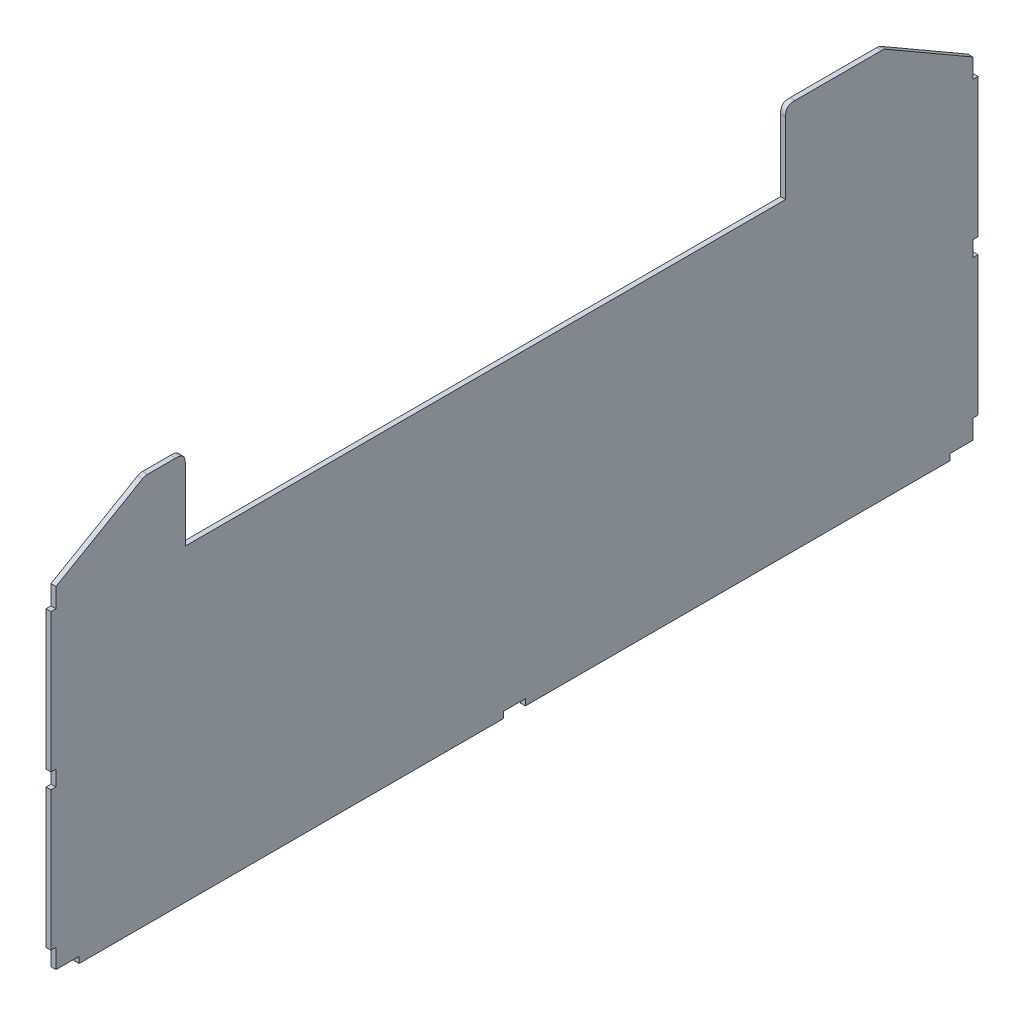
from build123d import *

# Parameters (mm, degrees)
BASE_FLANGE1_DEPTH  = 2.588
SKETCH2_W           = 2.588
SKETCH2_H           = 72
BOSS_EXTRUDE1_DEPTH = 2.588
SKETCH3_W           = 2.588
SKETCH3_H           = 220
BOSS_EXTRUDE2_DEPTH = 3.264
SKETCH4_W           = 2.588
SKETCH4_H           = 72
BOSS_EXTRUDE3_DEPTH = 2.5888
FILLET1_SIZE        = 5


# Sheet-metal steps are written as plain solids
with BuildPart() as part:
    # Base-Flange1: sheet metal written as solids
    # Sketch1 → Base-Flange1 (new body)
    with BuildSketch(Plane(origin=(0, 0, 0), x_dir=(0, 0, -1), z_dir=(1, 0, 0))):
        Polygon((0, 172), (46.072551481, 198.6), (67, 198.6), (67, 156.6), (378.084, 156.6), (378.084, 198.6), (429.151448519, 198.6), (475.224, 172), (475.224, 0), (0, 0), align=None)
    extrude(amount=-BASE_FLANGE1_DEPTH)

    # Sketch2 → Boss-Extrude1 (add)
    with BuildSketch(Plane(origin=(0, 0, -475.224), x_dir=(-1, 0, 0), z_dir=(0, 0, -1))):
        with Locations((1.294, 126)):
            Rectangle(SKETCH2_W, SKETCH2_H)
        with Locations((1.294, 46)):
            Rectangle(SKETCH2_W, SKETCH2_H)
    extrude(amount=BOSS_EXTRUDE1_DEPTH)

    # Sketch3 → Boss-Extrude2 (add)
    with BuildSketch(Plane.XZ):
        with Locations((-1.294, -122)):
            Rectangle(SKETCH3_W, SKETCH3_H)
        with Locations((-1.294, -353.224)):
            Rectangle(SKETCH3_W, SKETCH3_H)
    extrude(amount=BOSS_EXTRUDE2_DEPTH)

    # Sketch4 → Boss-Extrude3 (add)
    with BuildSketch(Plane.XY):
        with Locations((-1.294, 126)):
            Rectangle(SKETCH4_W, SKETCH4_H)
        with Locations((-1.294, 46)):
            Rectangle(SKETCH4_W, SKETCH4_H)
    extrude(amount=BOSS_EXTRUDE3_DEPTH)

    # Fillet1
    # a fillet whose section is not a circle: 5 mm, written as the material it takes off along each edge
    with BuildSketch(Plane(origin=(12.5, 198.6, -378.084), x_dir=(0, -1, 0), z_dir=(-1, 0, 0)), Plane(origin=(12.5, 198.6, -67), x_dir=(0, 0, 1), z_dir=(-1, 0, 0))) as fillet1_piece_1:
        with BuildLine():
            add(Edge.make_bspline([(FILLET1_SIZE, 0), (4.159009742, 0), (3.318019485, 0), (1.464466094, -0.358459599), (0.358459599, -1.464466094), (0, -3.318019485), (0, -4.159009742), (0, -FILLET1_SIZE)], knots=[0, 0, 0, 0, 0, 0, 0.5, 0.5, 1, 1, 1, 1, 1, 1], degree=5))
            Line((0, -FILLET1_SIZE), (0, 0))
            Line((0, 0), (FILLET1_SIZE, 0))
        make_face()
    extrude(amount=27.588, mode=Mode.SUBTRACT)
    with BuildSketch(Plane(origin=(3.349364905, 198.6, -429.151448519), x_dir=(0, 0, 1), z_dir=(-1, 0, 0)), Plane(origin=(3.349364905, 198.6, -46.072551481), x_dir=(0, -0.49999999999999534, 0.8660254037844413), z_dir=(-1, 0, 0))) as fillet1_piece_2:
        with BuildLine():
            add(Edge.make_bspline([(1.339745962, 0), (1.091155955, 0), (0.842565948, 0), (0.288878575, -0.029943211), (-0.235204579, -0.170370869), (-0.729683516, -0.421282974), (-0.944968777, -0.545577978), (-1.160254038, -0.669872981)], knots=[0, 0, 0, 0, 0, 0, 0.5, 0.5, 1, 1, 1, 1, 1, 1], degree=5))
            Line((-1.160254038, -0.669872981), (0, 0))
            Line((0, 0), (1.339745962, 0))
        make_face()
    extrude(amount=9.286729811, mode=Mode.SUBTRACT)


solid = part.part
